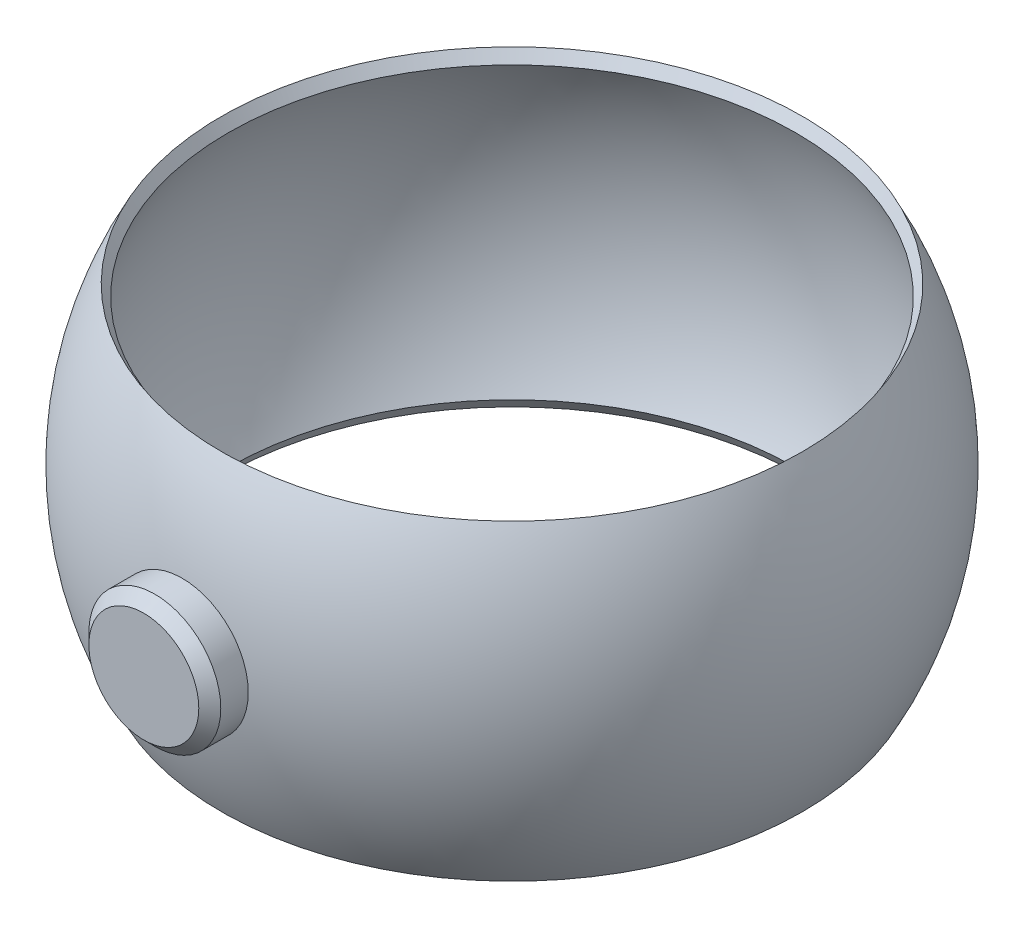
from build123d import *

# Parameters (mm, degrees)
SHELL2_T            = -0.5
SKETCH4_R           = 3
BOSS_EXTRUDE1_DEPTH = 1.75
CHAMFER5_SIZE       = 0.5


with BuildPart() as part:
    # Sketch2 → Revolve1 (revolve)
    with BuildSketch(Plane.XY):
        with BuildLine():
            Line((12.990381057, 7.5), (0, 7.5))
            Line((0, 7.5), (0, -7.5))
            Line((0, -7.5), (12.990381057, -7.5))
            ThreePointArc((12.990381057, -7.5), (15, 0), (12.990381057, 7.5))
        make_face()
    revolve(axis=Axis((0, 7.5, 0), (0, -1, 0)))

    # Shell2
    shell2_openings = [part.faces().sort_by_distance(p)[0] for p in [
        (0, -7.5, 0),
        (0, 7.5, 0),
    ]]
    offset(amount=SHELL2_T, openings=shell2_openings, kind=Kind.INTERSECTION)

    # Chamfer4
    # the kernel refuses this chamfer: 1.1 mm, written as the material it takes off along each edge
    with BuildSketch(Plane(origin=(0, 7.5, 0), x_dir=(1, 0, 0), z_dir=(0, 0, 1))) as chamfer4_piece_1:
        with BuildLine():
            Line((13.487785547, 0.03752893), (12.889305577, -0.940320222))
            Line((12.889305577, -0.940320222), (12.86971454, -0.95032978))
            ThreePointArc((12.86971454, -0.95032978), (12.65505268, -0.467068486), (12.390845176, -0.01137931))
            Line((12.390845176, -0.01137931), (12.409673646, 0.022))
            ThreePointArc((12.409673646, 0.022), (12.948729597, 0.022), (13.487785547, 0.05952893))
            Line((13.487785547, 0.05952893), (13.487785547, 0.03752893))
        make_face()
    revolve(axis=Axis((0, 7.5, 0), (0, 1, 0)), mode=Mode.SUBTRACT)
    with BuildSketch(Plane(origin=(0, -7.5, 0), x_dir=(1, 0, 0), z_dir=(0, 0, 1))) as chamfer4_piece_2:
        with BuildLine():
            Line((12.889305577, 0.940320222), (13.487785547, -0.03752893))
            Line((13.487785547, -0.03752893), (13.487785547, -0.05952893))
            ThreePointArc((13.487785547, -0.05952893), (12.948729597, -0.022), (12.409673646, -0.022))
            Line((12.409673646, -0.022), (12.390845176, 0.01137931))
            ThreePointArc((12.390845176, 0.01137931), (12.65505268, 0.467068486), (12.86971454, 0.95032978))
            Line((12.86971454, 0.95032978), (12.889305577, 0.940320222))
        make_face()
    revolve(axis=Axis((0, -7.5, 0), (0, 1, 0)), mode=Mode.SUBTRACT)


with BuildPart() as body_2:
    # Sketch4 → Boss-Extrude1 (new body)
    with BuildSketch(Plane.XY.offset(15)):
        Circle(SKETCH4_R)
    extrude(amount=BOSS_EXTRUDE1_DEPTH)

    # Chamfer5
    chamfer5_edges = [body_2.edges().sort_by_distance(p)[0] for p in [
        (-3, 0, 16.75),
    ]]
    chamfer(chamfer5_edges, length=CHAMFER5_SIZE)


solid = Compound([part.part, body_2.part])
